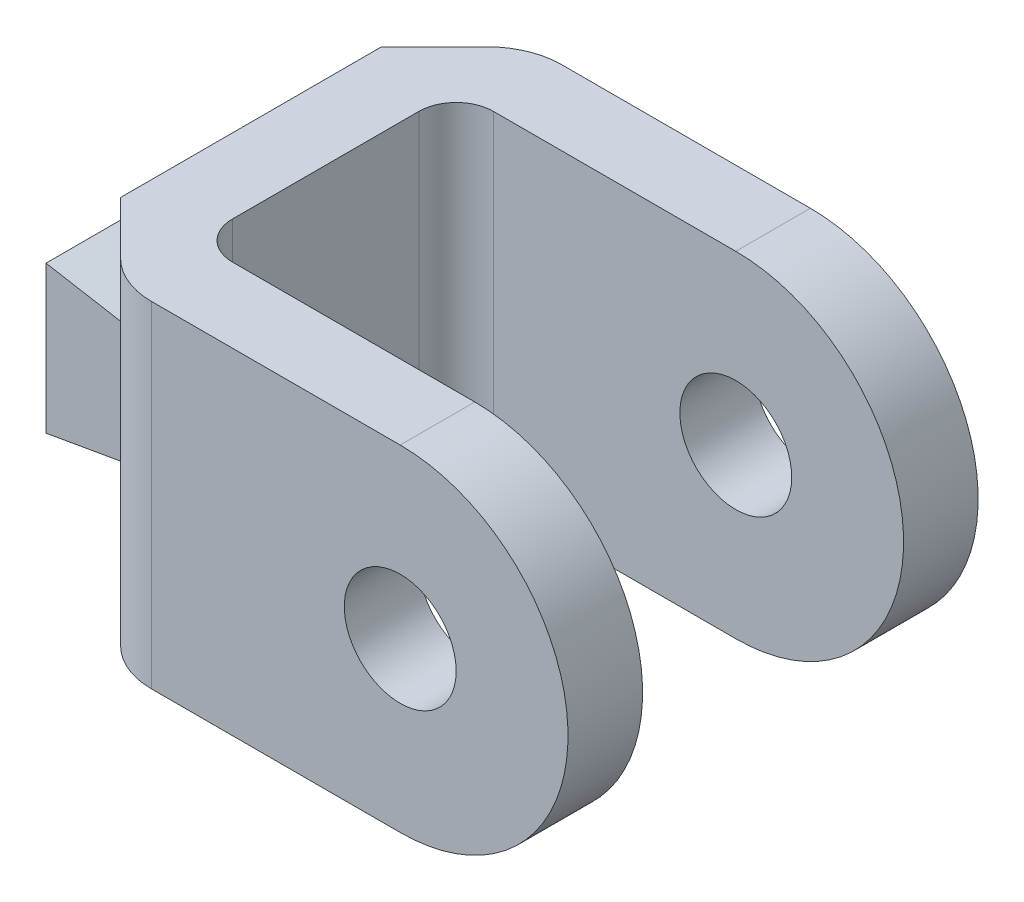
from build123d import *

# Parameters (mm, degrees)
BOSS_EXTRUDE2_DEPTH  = 7
SKETCH2_R            = 1.5
BOSS_EXTRUDE3_DEPTH  = 2
CUT_EXTRUDE3_DEPTH   = 19.055470085
FILLET1_R            = 1
FILLET2_R            = 2
FILLET2_OF_MIRROR2_R = 2
FILLET3_R            = 1


with BuildPart() as part:
    # Sketch1 → Boss-Extrude2 (new body)
    with BuildSketch(Plane.XY):
        Polygon((0, -1.625), (-2, -1.975), (-2, 1.975), (0, 1.625), (0, 4.5), (2, 4.5), (2, -4.5), (0, -4.5), align=None)
    boss_extrude2 = extrude(amount=BOSS_EXTRUDE2_DEPTH)

    # Sketch2 → Boss-Extrude3 (add)
    with BuildSketch(Plane.XY):
        with BuildLine():
            Line((0, 4.5), (9.5, 4.5))
            ThreePointArc((9.5, 4.5), (14, 0), (9.5, -4.5))
            Line((9.5, -4.5), (0, -4.5))
            Line((0, -4.5), (0, 4.5))
        make_face()
        with Locations((9.5, 0)):
            Circle(SKETCH2_R, mode=Mode.SUBTRACT)
    boss_extrude3 = extrude(amount=-BOSS_EXTRUDE3_DEPTH)

    # Sketch4 → Cut-Extrude3 (cut, through all)
    with BuildSketch(Plane(origin=(0, 4.5, 0), x_dir=(1, 0, 0), z_dir=(0, 1, 0))):
        Polygon((0, 0), (2, 2), (0, 2), align=None)
    cut_extrude3 = extrude(amount=-CUT_EXTRUDE3_DEPTH, mode=Mode.SUBTRACT)

    # Fillet1
    fillet1_edges = [part.edges().sort_by_distance(p)[0] for p in [
        (2, 0, 0),
    ]]
    fillet(fillet1_edges, radius=FILLET1_R)

    # Fillet2
    fillet2_edges = [part.edges().sort_by_distance(p)[0] for p in [
        (2, 0, -2),
    ]]
    fillet(fillet2_edges, radius=FILLET2_R)

    # Mirror2: Boss-Extrude2, Boss-Extrude3, Cut-Extrude3 across plane
    add(boss_extrude2.mirror(Plane.XY.offset(3.5)))
    add(boss_extrude3.mirror(Plane.XY.offset(3.5)))
    add(cut_extrude3.mirror(Plane.XY.offset(3.5)), mode=Mode.SUBTRACT)

    # Fillet2 of Mirror2
    fillet2_of_mirror2_edges = [part.edges().sort_by_distance(p)[0] for p in [
        (2, 0, 9),
    ]]
    fillet(fillet2_of_mirror2_edges, radius=FILLET2_OF_MIRROR2_R)

    # Fillet3
    fillet3_edges = [part.edges().sort_by_distance(p)[0] for p in [
        (2, 0, 7),
    ]]
    fillet(fillet3_edges, radius=FILLET3_R)


solid = part.part
